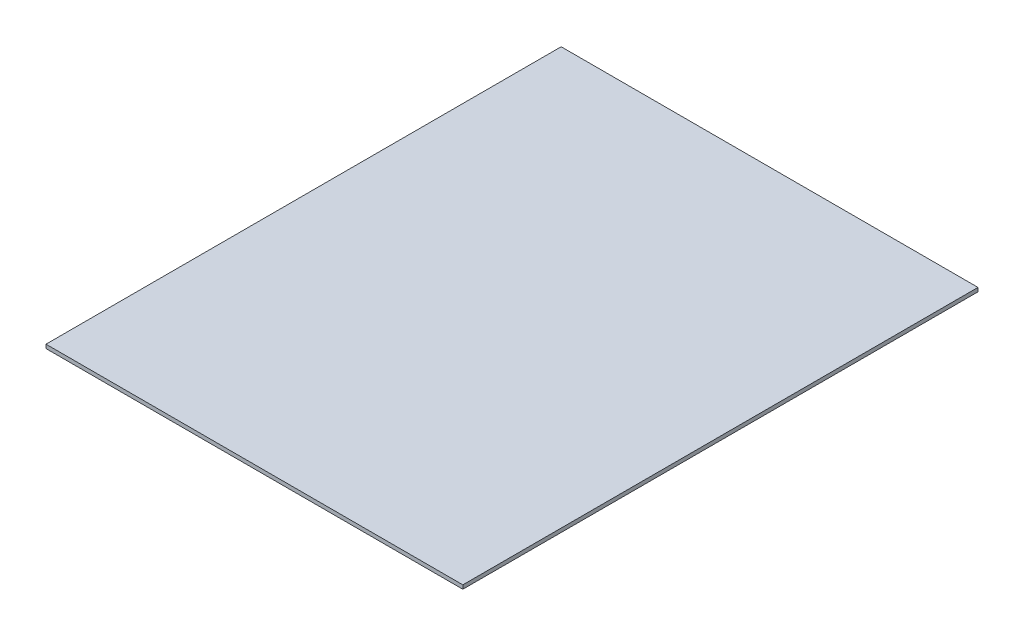
from build123d import *

# Parameters (mm, degrees)
SKETCH1_W           = 326
SKETCH1_H           = 402.9
BOSS_EXTRUDE1_DEPTH = 3


with BuildPart() as part:
    # Sketch1 → Boss-Extrude1 (new body)
    with BuildSketch(Plane(origin=(0, 0, 0), x_dir=(1, 0, 0), z_dir=(0, 1, 0))):
        Rectangle(SKETCH1_W, SKETCH1_H)
    extrude(amount=BOSS_EXTRUDE1_DEPTH)


solid = part.part
